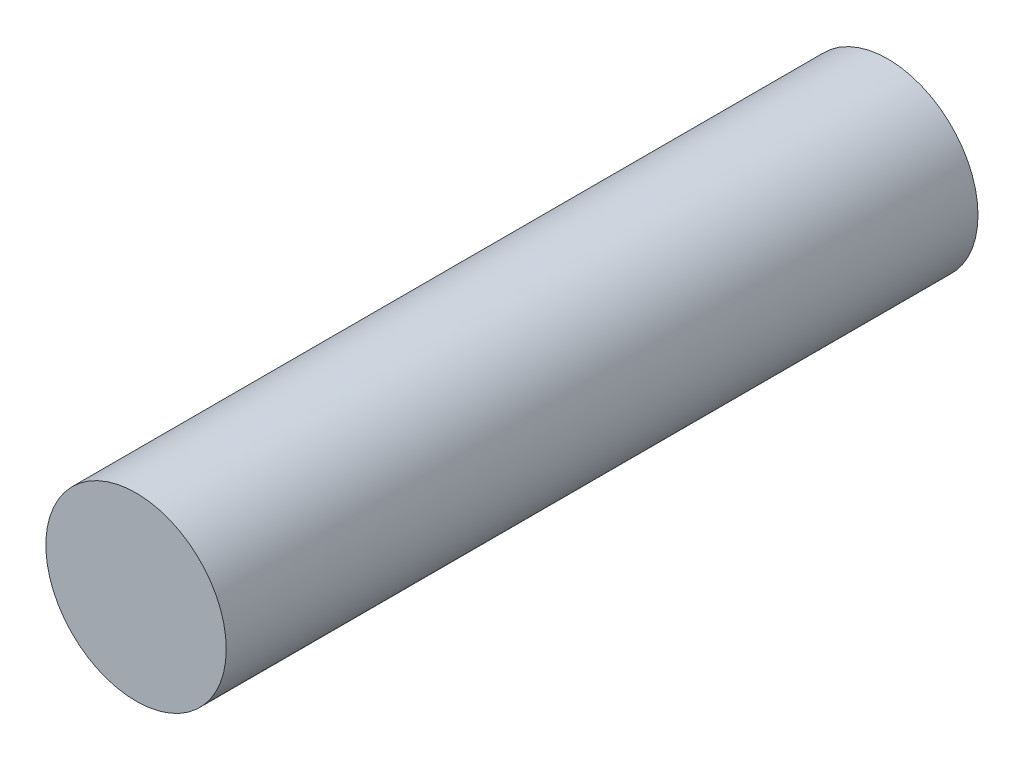
from build123d import *

# Parameters (mm, degrees)
ESQUISSE3_W = 12
ESQUISSE3_H = 100


with BuildPart() as part:
    # Esquisse3 → cylindre primitif (revolve)
    with BuildSketch(Plane(origin=(0, 0, 0), x_dir=(1, 0, 0), z_dir=(0, 1, 0))):
        with Locations((-6, 0)):
            Rectangle(ESQUISSE3_W, ESQUISSE3_H)
    revolve(axis=Axis((0, 0, 50), (0, 0, -1)))


solid = part.part
